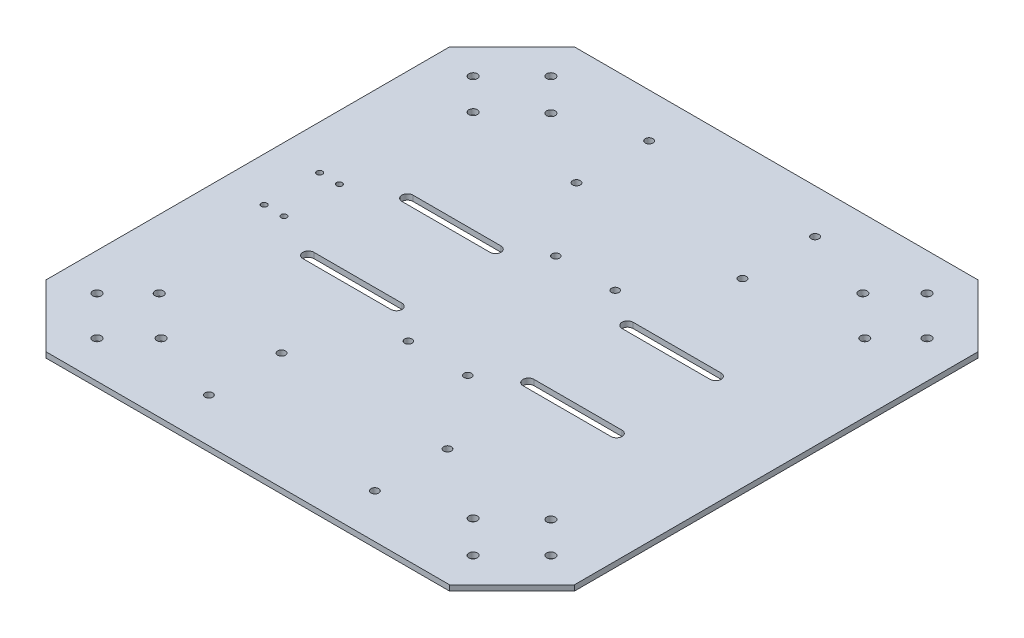
from build123d import *

# Parameters (mm, degrees)
BOSS_EXTRUDE1_DEPTH = 3.175
SKETCH2_R           = 2.4638
CUT_EXTRUDE1_DEPTH  = 6.35
SKETCH3_R           = 2.159
CUT_EXTRUDE2_DEPTH  = 6.35
SKETCH4_R           = 2.2225
CUT_EXTRUDE3_DEPTH  = 351.937720963
SKETCH5_R           = 1.651
CUT_EXTRUDE4_DEPTH  = 351.937720963


with BuildPart() as part:
    # Sketch1 → Boss-Extrude1 (new body)
    with BuildSketch(Plane(origin=(0, 0, 0), x_dir=(1, 0, 0), z_dir=(0, 1, 0))):
        Polygon((-25.845025354, 51.656360067), (-61.766049839, 15.735335583), (-61.766049839, -217.222615449), (-25.845025354, -253.143639933), (207.112925677, -253.143639933), (243.033950161, -217.222615449), (243.033950161, 15.735335583), (207.112925677, 51.656360067), align=None)
        with BuildLine():
            ThreePointArc((52.533950161, -126.143639933), (55.708950161, -129.318639933), (52.533950161, -132.493639933))
            Line((52.533950161, -132.493639933), (1.733950161, -132.493639933))
            ThreePointArc((1.733950161, -132.493639933), (-1.441049839, -129.318639933), (1.733950161, -126.143639933))
            Line((1.733950161, -126.143639933), (52.533950161, -126.143639933))
        make_face(mode=Mode.SUBTRACT)
        with BuildLine():
            Line((179.533950161, -132.493639933), (128.733950161, -132.493639933))
            ThreePointArc((128.733950161, -132.493639933), (125.558950161, -129.318639933), (128.733950161, -126.143639933))
            Line((128.733950161, -126.143639933), (179.533950161, -126.143639933))
            ThreePointArc((179.533950161, -126.143639933), (182.708950161, -129.318639933), (179.533950161, -132.493639933))
        make_face(mode=Mode.SUBTRACT)
        with BuildLine():
            Line((1.733950161, -68.993639933), (52.533950161, -68.993639933))
            ThreePointArc((52.533950161, -68.993639933), (55.708950161, -72.168639933), (52.533950161, -75.343639933))
            Line((52.533950161, -75.343639933), (1.733950161, -75.343639933))
            ThreePointArc((1.733950161, -75.343639933), (-1.441049839, -72.168639933), (1.733950161, -68.993639933))
        make_face(mode=Mode.SUBTRACT)
        with BuildLine():
            ThreePointArc((128.733950161, -75.343639933), (125.558950161, -72.168639933), (128.733950161, -68.993639933))
            Line((128.733950161, -68.993639933), (179.533950161, -68.993639933))
            ThreePointArc((179.533950161, -68.993639933), (182.708950161, -72.168639933), (179.533950161, -75.343639933))
            Line((179.533950161, -75.343639933), (128.733950161, -75.343639933))
        make_face(mode=Mode.SUBTRACT)
    extrude(amount=BOSS_EXTRUDE1_DEPTH)

    # Sketch2 → Cut-Extrude1 (cut)
    with BuildSketch(Plane(origin=(0, 3.175, 0), x_dir=(1, 0, 0), z_dir=(0, 1, 0))):
        with Locations((-17.872380726, 30.213331256)):
            Circle(SKETCH2_R)
        with Locations((0.640891541, 11.70005899)):
            Circle(SKETCH2_R)
        with Locations((-22.362508786, -10.197821288)):
            Circle(SKETCH2_R)
        with Locations((-40.323021028, 7.762690954)):
            Circle(SKETCH2_R)
        with Locations((203.630409109, -10.197821288)):
            Circle(SKETCH2_R)
        with Locations((221.590921351, 7.762690954)):
            Circle(SKETCH2_R)
        with Locations((180.627008782, 11.70005899)):
            Circle(SKETCH2_R)
        with Locations((199.140281048, 30.213331256)):
            Circle(SKETCH2_R)
        with Locations((-22.362508786, -191.289458578)):
            Circle(SKETCH2_R)
        with Locations((-40.323021028, -209.24997082)):
            Circle(SKETCH2_R)
        with Locations((-17.872380726, -231.700611123)):
            Circle(SKETCH2_R)
        with Locations((0.640891541, -213.187338857)):
            Circle(SKETCH2_R)
        with Locations((221.590921351, -209.24997082)):
            Circle(SKETCH2_R)
        with Locations((199.140281048, -231.700611123)):
            Circle(SKETCH2_R)
        with Locations((180.627008782, -213.187338857)):
            Circle(SKETCH2_R)
        with Locations((203.630409109, -191.289458578)):
            Circle(SKETCH2_R)
    extrude(amount=-CUT_EXTRUDE1_DEPTH, mode=Mode.SUBTRACT)

    # Sketch3 → Cut-Extrude2 (cut)
    with BuildSketch(Plane(origin=(0, 3.175, 0), x_dir=(1, 0, 0), z_dir=(0, 1, 0))):
        with Locations((73.361950161, -58.198639933)):
            Circle(SKETCH3_R)
        with Locations((107.651950161, -58.198639933)):
            Circle(SKETCH3_R)
        with Locations((73.361950161, -143.288639933)):
            Circle(SKETCH3_R)
        with Locations((107.651950161, -143.288639933)):
            Circle(SKETCH3_R)
    extrude(amount=-CUT_EXTRUDE2_DEPTH, mode=Mode.SUBTRACT)

    # Sketch4 → Cut-Extrude3 (cut, through all)
    with BuildSketch(Plane(origin=(0, 3.175, 0), x_dir=(1, 0, 0), z_dir=(0, 1, 0))):
        with Locations((42.754950161, 26.256360067)):
            Circle(SKETCH4_R)
        with Locations((138.512950161, 26.256360067)):
            Circle(SKETCH4_R)
        with Locations((42.754950161, -15.653639933)):
            Circle(SKETCH4_R)
        with Locations((138.512950161, -15.653639933)):
            Circle(SKETCH4_R)
        with Locations((138.512950161, -185.833639933)):
            Circle(SKETCH4_R)
        with Locations((42.754950161, -185.833639933)):
            Circle(SKETCH4_R)
        with Locations((138.512950161, -227.743639933)):
            Circle(SKETCH4_R)
        with Locations((42.754950161, -227.743639933)):
            Circle(SKETCH4_R)
    extrude(amount=-CUT_EXTRUDE3_DEPTH, mode=Mode.SUBTRACT)

    # Sketch5 → Cut-Extrude4 (cut, through all)
    with BuildSketch(Plane(origin=(0, 3.175, 0), x_dir=(1, 0, 0), z_dir=(0, 1, 0))):
        with Locations((-36.366049839, -84.741639933)):
            Circle(SKETCH5_R)
        with Locations((-24.936049839, -84.741639933)):
            Circle(SKETCH5_R)
        with Locations((-24.936049839, -116.745639933)):
            Circle(SKETCH5_R)
        with Locations((-36.366049839, -116.745639933)):
            Circle(SKETCH5_R)
    extrude(amount=-CUT_EXTRUDE4_DEPTH, mode=Mode.SUBTRACT)


solid = part.part
